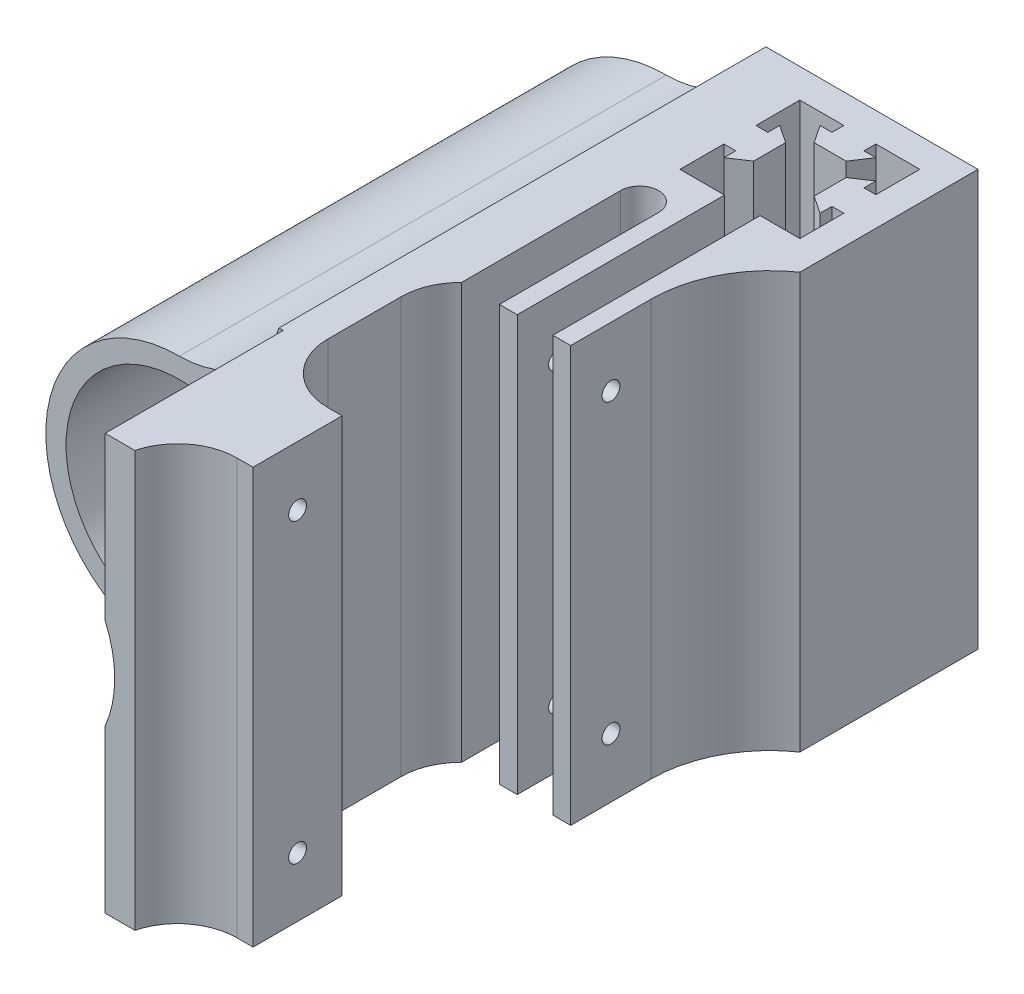
from build123d import *

# Parameters (mm, degrees)
SKETCH4_R            = 19.1
BOSS_EXTRUDE4_DEPTH  = 80
BOSS_EXTRUDE5_START  = 2
BOSS_EXTRUDE5_DEPTH  = 2
SKETCH6_R            = 5
CUT_EXTRUDE1_DEPTH   = 2
BOSS_EXTRUDE7_DEPTH  = 30
SKETCH8_R            = 11
CUT_EXTRUDE2_DEPTH   = 30
SKETCH9_R            = 1.5
CUT_EXTRUDE3_DEPTH   = 30
SKETCH11_W           = 5
SKETCH11_H           = 112
BOSS_EXTRUDE8_DEPTH  = 20
SKETCH12_W           = 5
SKETCH12_H           = 112
BOSS_EXTRUDE9_DEPTH  = 20
SKETCH13_R           = 1.5
CUT_EXTRUDE4_DEPTH   = 20
SKETCH14_R           = 1.5
CUT_EXTRUDE5_DEPTH   = 20
SKETCH16_W           = 30
SKETCH16_H           = 70
BOSS_EXTRUDE10_DEPTH = 30
SKETCH21_W           = 6
SKETCH21_H           = 4.9
CUT_EXTRUDE6_DEPTH   = 70
SKETCH23_W           = 3
SKETCH23_H           = 70
BOSS_EXTRUDE11_DEPTH = 30
FILLET5_R            = 3.2
FILLET6_R            = 20
SKETCH26_W           = 112
SKETCH26_H           = 40
CUT_EXTRUDE10_DEPTH  = 15
SKETCH27_W           = 6.865199721
SKETCH27_H           = 6.850856093
SKETCH27_W_2         = 7.923200186
SKETCH27_H_2         = 5.884780205
CUT_EXTRUDE11_DEPTH  = 131.000961535
SKETCH28_W           = 12.4
SKETCH28_H           = 15
BOSS_EXTRUDE12_DEPTH = 70
FILLET7_R            = 10
SKETCH29_R           = 1.5
CUT_EXTRUDE12_DEPTH  = 129.917648132
SKETCH30_R           = 1.5
CUT_EXTRUDE13_DEPTH  = 15
FILLET8_R            = 10


# Some blends are built 0.0001 mm under size
with BuildPart() as part:
    # Sketch4 → Boss-Extrude4 (new body)
    with BuildSketch(Plane.XY):
        with BuildLine():
            Line((22.5, 0), (22.5, -60))
            Line((22.5, -60), (17.5, -60))
            Line((17.5, -60), (17.5, -40))
            ThreePointArc((17.5, -40), (12.374368671, -27.625631329), (0, -22.5))
            ThreePointArc((0, -22.5), (-22.5, 0), (0, 22.5))
            ThreePointArc((0, 22.5), (12.374368671, 27.625631329), (17.5, 40))
            Line((17.5, 40), (17.5, 60))
            Line((17.5, 60), (22.5, 60))
            Line((22.5, 60), (22.5, 0))
        make_face()
        Circle(SKETCH4_R, mode=Mode.SUBTRACT)
    extrude(amount=BOSS_EXTRUDE4_DEPTH)

    # Sketch5 → Boss-Extrude5 (add)
    with BuildSketch(Plane(origin=(0, 0, 0), x_dir=(-1, 0, 0), z_dir=(0, 0, -1)).offset(BOSS_EXTRUDE5_START)):
        with BuildLine():
            Line((-17.5, 60), (-22.5, 60))
            Line((-22.5, 60), (-22.5, -60))
            Line((-22.5, -60), (-17.5, -60))
            Line((-17.5, -60), (-17.5, -40))
            ThreePointArc((-17.5, -40), (-12.374368671, -27.625631329), (0, -22.5))
            ThreePointArc((0, -22.5), (22.5, 0), (0, 22.5))
            ThreePointArc((0, 22.5), (-12.374368671, 27.625631329), (-17.5, 40))
            Line((-17.5, 40), (-17.5, 60))
        make_face()
    extrude(amount=-BOSS_EXTRUDE5_DEPTH)

    # Sketch6 → Cut-Extrude1 (cut)
    with BuildSketch(Plane(origin=(0, 0, -2), x_dir=(-1, 0, 0), z_dir=(0, 0, -1))):
        Circle(SKETCH6_R)
    extrude(amount=-CUT_EXTRUDE1_DEPTH, mode=Mode.SUBTRACT)

    # Sketch7 → Boss-Extrude7 (add)
    with BuildSketch(Plane.XY.offset(80)):
        with BuildLine():
            Line((17.5, 60), (17.5, 7.652450588))
            ThreePointArc((17.5, 7.652450588), (19.1, 0), (17.5, -7.652450588))
            Line((17.5, -7.652450588), (17.5, -60))
            Line((17.5, -60), (22.5, -60))
            Line((22.5, -60), (22.5, 60))
            Line((22.5, 60), (17.5, 60))
        make_face()
    extrude(amount=BOSS_EXTRUDE7_DEPTH)

    # Sketch8 → Cut-Extrude2 (cut)
    with BuildSketch(Plane(origin=(0, 0, -2), x_dir=(-1, 0, 0), z_dir=(0, 0, -1))):
        Circle(SKETCH8_R)
    extrude(amount=-CUT_EXTRUDE2_DEPTH, mode=Mode.SUBTRACT)

    # Sketch9 → Cut-Extrude3 (cut)
    with BuildSketch(Plane(origin=(0, 0, -2), x_dir=(-1, 0, 0), z_dir=(0, 0, -1))):
        with Locations((0, 13.5)):
            Circle(SKETCH9_R)
        with Locations((13.5, 0)):
            Circle(SKETCH9_R)
        with Locations((0, -13.5)):
            Circle(SKETCH9_R)
        with Locations((-13.5, 0)):
            Circle(SKETCH9_R)
    extrude(amount=-CUT_EXTRUDE3_DEPTH, mode=Mode.SUBTRACT)

    # Sketch11 → Boss-Extrude8 (add)
    with BuildSketch(Plane.XZ.offset(60)):
        with Locations((20, 54)):
            Rectangle(SKETCH11_W, SKETCH11_H)
    extrude(amount=BOSS_EXTRUDE8_DEPTH)

    # Sketch12 → Boss-Extrude9 (add)
    with BuildSketch(Plane(origin=(0, 60, 0), x_dir=(1, 0, 0), z_dir=(0, 1, 0))):
        with Locations((20, -54)):
            Rectangle(SKETCH12_W, SKETCH12_H)
    extrude(amount=BOSS_EXTRUDE9_DEPTH)

    # Sketch13 → Cut-Extrude4 (cut)
    with BuildSketch(Plane.ZY.offset(-17.5)):
        with Locations((26, 60)):
            Circle(SKETCH13_R)
        with Locations((54, 60)):
            Circle(SKETCH13_R)
        with Locations((82, 60)):
            Circle(SKETCH13_R)
        with Locations((82, -60)):
            Circle(SKETCH13_R)
        with Locations((54, -60)):
            Circle(SKETCH13_R)
        with Locations((26, -60)):
            Circle(SKETCH13_R)
    extrude(amount=-CUT_EXTRUDE4_DEPTH, mode=Mode.SUBTRACT)

    # Sketch14 → Cut-Extrude5 (cut)
    with BuildSketch(Plane.ZY.offset(-17.5)):
        with Locations((95, 37.652450588)):
            Circle(SKETCH14_R)
        with Locations((95, -37.652450588)):
            Circle(SKETCH14_R)
    extrude(amount=-CUT_EXTRUDE5_DEPTH, mode=Mode.SUBTRACT)

    # Sketch16 → Boss-Extrude10 (add)
    with BuildSketch(Plane(origin=(22.5, 0, 0), x_dir=(0, 0, -1), z_dir=(1, 0, 0))):
        with Locations((-13, 0)):
            Rectangle(SKETCH16_W, SKETCH16_H)
    extrude(amount=BOSS_EXTRUDE10_DEPTH)

    # Sketch21 → Cut-Extrude6 (cut)
    with BuildSketch(Plane(origin=(0, 35, 0), x_dir=(1, 0, 0), z_dir=(0, 1, 0))):
        Polygon((34.8, -2.9), (27.4, -2.9), (27.4, -10.3), (29.4, -10.3), (29.4, -8.3), (32.4, -10.3), (32.4, -15.7), (29.4, -17.7), (29.4, -15.7), (27.4, -15.7), (27.4, -23.1), (34.9, -23.1), (40.9, -23.1), (47.6, -23.1), (47.6, -15.7), (45.6, -15.7), (45.6, -17.7), (42.6, -15.7), (42.6, -10.3), (45.6, -8.3), (45.6, -10.3), (47.6, -10.3), (47.6, -2.9), (40.2, -2.9), (40.2, -4.9), (42.2, -4.9), (40.2, -7.9), (34.8, -7.9), (32.8, -4.9), (34.8, -4.9), align=None)
        with Locations((37.9, -25.55)):
            Rectangle(SKETCH21_W, SKETCH21_H)
    extrude(amount=-CUT_EXTRUDE6_DEPTH, mode=Mode.SUBTRACT)

    # Sketch23 → Boss-Extrude11 (add)
    with BuildSketch(Plane.XY.offset(28)):
        with Locations((42.4, 0)):
            Rectangle(SKETCH23_W, SKETCH23_H)
        with Locations((24, 0)):
            Rectangle(SKETCH23_W, SKETCH23_H)
        with Locations((33.4, 0)):
            Rectangle(SKETCH23_W, SKETCH23_H)
    extrude(amount=BOSS_EXTRUDE11_DEPTH)

    # Fillet5
    fillet5_edges = [part.edges().sort_by_distance(p)[0] for p in [
        (25.5, 0, 28),
        (31.9, 0, 28),
    ]]
    fillet(fillet5_edges, radius=FILLET5_R - 0.0001)  # a hair under: the kernel refuses the full size

    # Fillet6
    # the kernel refuses this fillet: 20 mm, written as the material it adds along each edge
    with BuildSketch(Plane(origin=(43.9, 35, 28), x_dir=(1, 0, 0), z_dir=(0, -1, 0))) as fillet6_piece_1:
        with BuildLine():
            CenterArc((20, 16.432893841), FILLET6_R, 180, 55.249774246)
            Line((0, 16.432893841), (-0.4, 16.432893841))
            Line((-0.4, 16.432893841), (-0.4, 0))
            Line((-0.4, 0), (0, -0.4))
            ThreePointArc((0, -0.4), (4.3, -0.4), (8.372, -0.328657877))
            Line((8.372, -0.328657877), (8.6, 0))
        make_face()
    extrude(amount=70)

    # Sketch26 → Cut-Extrude10 (cut)
    with BuildSketch(Plane.ZY.offset(-17.5)):
        with Locations((54, -60)):
            Rectangle(SKETCH26_W, SKETCH26_H)
        with Locations((54, 60)):
            Rectangle(SKETCH26_W, SKETCH26_H)
    extrude(amount=-CUT_EXTRUDE10_DEPTH, mode=Mode.SUBTRACT)

    # Sketch27 → Cut-Extrude11 (cut, through all)
    with BuildSketch(Plane(origin=(0, 0, -2), x_dir=(-1, 0, 0), z_dir=(0, 0, -1))):
        with Locations((-19.06740014, 38.425428047)):
            Rectangle(SKETCH27_W, SKETCH27_H)
        with Locations((-18.538399907, -37.942390102)):
            Rectangle(SKETCH27_W_2, SKETCH27_H_2)
    extrude(amount=-CUT_EXTRUDE11_DEPTH, mode=Mode.SUBTRACT)

    # Sketch28 → Boss-Extrude12 (add)
    with BuildSketch(Plane(origin=(0, 35, 0), x_dir=(1, 0, 0), z_dir=(0, 1, 0))):
        with Locations((28.7, -95)):
            Rectangle(SKETCH28_W, SKETCH28_H)
    extrude(amount=-BOSS_EXTRUDE12_DEPTH)

    # Fillet7
    # the kernel refuses this fillet: 10 mm, written as the material it adds along each edge
    with BuildSketch(Plane(origin=(22.5, 35, 102.5), x_dir=(0, 0, 1), z_dir=(0, -1, 0))) as fillet7_piece_1:
        with BuildLine():
            CenterArc((10, -9.682458366), FILLET7_R, 104.477512186, 75.522487814)
            Line((0, -9.682458366), (-0.2, -9.682458366))
            Line((-0.2, -9.682458366), (-0.2, 0))
            Line((-0.2, 0), (0, 0.2))
            ThreePointArc((0, 0.2), (3.75, 0.2), (7.45, 0.193649167))
            Line((7.45, 0.193649167), (7.5, 0))
        make_face()
    extrude(amount=70)
    with BuildSketch(Plane(origin=(22.5, 35, 87.5), x_dir=(0, 0, -1), z_dir=(0, -1, 0))) as fillet7_piece_2:
        with BuildLine():
            CenterArc((FILLET7_R, FILLET7_R), FILLET7_R, 180, 90)
            Line((0, FILLET7_R), (-FILLET7_R * 0.02, FILLET7_R))
            Line((-FILLET7_R * 0.02, FILLET7_R), (-FILLET7_R * 0.02, -FILLET7_R * 0.02))
            Line((-FILLET7_R * 0.02, -FILLET7_R * 0.02), (FILLET7_R, -FILLET7_R * 0.02))
            Line((FILLET7_R, -FILLET7_R * 0.02), (FILLET7_R, 0))
        make_face()
    extrude(amount=70)

    # Sketch29 → Cut-Extrude12 (cut, through all)
    with BuildSketch(Plane(origin=(34.9, 0, 0), x_dir=(0, 0, -1), z_dir=(1, 0, 0))):
        with Locations((-95, 25)):
            Circle(SKETCH29_R)
        with Locations((-95, -25)):
            Circle(SKETCH29_R)
    extrude(amount=-CUT_EXTRUDE12_DEPTH, mode=Mode.SUBTRACT)

    # Sketch30 → Cut-Extrude13 (cut)
    with BuildSketch(Plane(origin=(43.9, 0, 0), x_dir=(0, 0, -1), z_dir=(1, 0, 0))):
        with Locations(Location((-51.216446921, 25, 0), (0, 0, 90))):
            Circle(SKETCH30_R)
        with Locations(Location((-51.216446921, -25, 0), (0, 0, 90))):
            Circle(SKETCH30_R)
    extrude(amount=-CUT_EXTRUDE13_DEPTH, mode=Mode.SUBTRACT)

    # Fillet8
    # the kernel refuses this fillet: 10 mm, written as the material it adds along each edge
    with BuildSketch(Plane(origin=(22.5, -35, 58), x_dir=(0, 0, 1), z_dir=(0, 1, 0))) as fillet8_piece_1:
        with BuildLine():
            CenterArc((7.141428429, 10), FILLET8_R, 224.427004001, 45.572995999)
            Line((0, 3), (-0.142828569, 2.86))
            ThreePointArc((-0.142828569, 2.86), (-0.2, 1.5), (-0.2, 0))
            Line((-0.2, 0), (0, -0.2))
            Line((0, -0.2), (7.141428429, -0.2))
            Line((7.141428429, -0.2), (7.141428429, 0))
        make_face()
    extrude(amount=70)


solid = part.part
